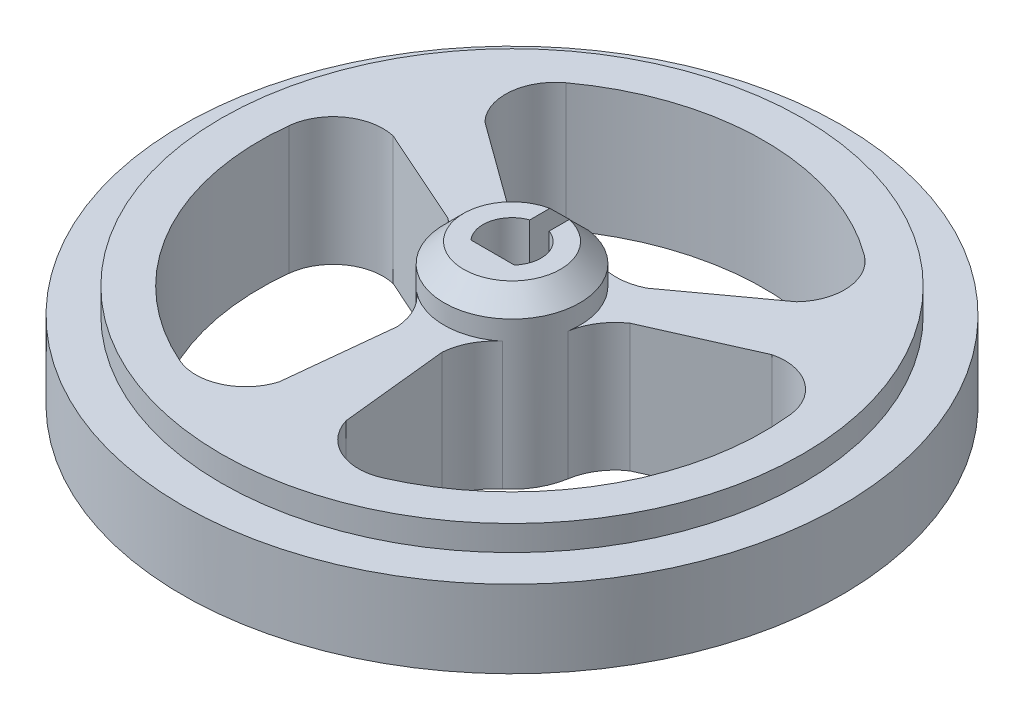
from build123d import *
from build123d.topology import SkipClean

# Parameters (mm, degrees)
SKETCH_1_R          = 15
EXTRUDE_1_DEPTH     = 6.6
EXTRUDE_2_DEPTH     = 2
SKETCH_3_R          = 17
SKETCH_3_R_2        = 15
EXTRUDE_3_DEPTH     = 5.3
SKETCH_4_R          = 17
SKETCH_4_R_2        = 15
CUT_EXTRUDE_3_DEPTH = 1.3


with BuildPart() as part:
    # 草图1 → 凸台-拉伸1 (new body)
    with BuildSketch(Plane(origin=(0, 0, 0), x_dir=(1, 0, 0), z_dir=(0, 1, 0))):
        with Locations(Location((0, 0, 0), (0, 0, 270))):
            Circle(SKETCH_1_R)
        with BuildLine():
            Line((1.118033989, -1), (-1.118033989, -1))
            ThreePointArc((-1.118033989, -1), (-1.4531398, 0.37200097), (-0.5, 1.414213562))
            Line((-0.5, 1.414213562), (-0.5, 3.464101615))
            ThreePointArc((-0.5, 3.464101615), (-0.874472135, 3.388996678), (-1.23853126, 3.273536363))
            ThreePointArc((-1.23853126, 3.273536363), (-2.407810688, 3.08721539), (-3.555224024, 3.379401158))
            Line((-3.555224024, 3.379401158), (-8.04299568, 6.641703286))
            ThreePointArc((-8.04299568, 6.641703286), (-8.733606232, 8.638127636), (-7.69519148, 10.477787366))
            ThreePointArc((-7.69519148, 10.477787366), (0, 13), (7.69519148, 10.477787366))
            ThreePointArc((7.69519148, 10.477787366), (8.733606232, 8.638127636), (8.04299568, 6.641703286))
            Line((8.04299568, 6.641703286), (3.555224024, 3.379401158))
            ThreePointArc((3.555224024, 3.379401158), (2.407810688, 3.08721539), (1.23853126, 3.273536363))
            ThreePointArc((1.23853126, 3.273536363), (0.874472135, 3.388996678), (0.5, 3.464101615))
            Line((0.5, 3.464101615), (0.5, 1.414213562))
            ThreePointArc((0.5, 1.414213562), (1.4531398, 0.37200097), (1.118033989, -1))
        make_face(mode=Mode.SUBTRACT)
        with BuildLine():
            Line((-1.149035241, -4.7686149), (-1.73038593, -10.286290225))
            ThreePointArc((-1.73038593, -10.286290225), (-3.114034858, -11.882588681), (-5.226434294, -11.903124992))
            ThreePointArc((-5.226434294, -11.903124992), (-11.258330249, -6.5), (-12.921625774, 1.425337626))
            ThreePointArc((-12.921625774, 1.425337626), (-11.847641089, 3.244461045), (-9.77338161, 3.644586939))
            Line((-9.77338161, 3.644586939), (-4.704259264, 1.389213742))
            ThreePointArc((-4.704259264, 1.389213742), (-3.877512299, 0.541617529), (-3.45423128, -0.564168647))
            ThreePointArc((-3.45423128, -0.564168647), (-3.031088913, -1.75), (-2.21570002, -2.709367716))
            ThreePointArc((-2.21570002, -2.709367716), (-1.469701611, -3.628832918), (-1.149035241, -4.7686149))
        make_face(mode=Mode.SUBTRACT)
        with BuildLine():
            Line((1.149035241, -4.7686149), (1.73038593, -10.286290225))
            ThreePointArc((1.73038593, -10.286290225), (3.114034858, -11.882588681), (5.226434294, -11.903124992))
            ThreePointArc((5.226434294, -11.903124992), (11.258330249, -6.5), (12.921625774, 1.425337626))
            ThreePointArc((12.921625774, 1.425337626), (11.847641089, 3.244461045), (9.77338161, 3.644586939))
            Line((9.77338161, 3.644586939), (4.704259264, 1.389213742))
            ThreePointArc((4.704259264, 1.389213742), (3.877512299, 0.541617529), (3.45423128, -0.564168647))
            ThreePointArc((3.45423128, -0.564168647), (3.031088913, -1.75), (2.21570002, -2.709367716))
            ThreePointArc((2.21570002, -2.709367716), (1.469701611, -3.628832918), (1.149035241, -4.7686149))
        make_face(mode=Mode.SUBTRACT)
    extrude(amount=EXTRUDE_1_DEPTH)

    # 草图2 → 凸台-拉伸2 (add)
    with BuildSketch(Plane(origin=(0, 6.6, 0), x_dir=(1, 0, 0), z_dir=(0, 1, 0))):
        with BuildLine():
            ThreePointArc((3.45423128, -0.564168647), (3.488539055, -0.283011059), (3.5, 0))
            ThreePointArc((3.5, 0), (2.879657915, 1.989364294), (1.23853126, 3.273536363))
            ThreePointArc((1.23853126, 3.273536363), (0.874472135, 3.388996678), (0.5, 3.464101615))
            Line((0.5, 3.464101615), (0.5, 1.414213562))
            ThreePointArc((0.5, 1.414213562), (1.4531398, 0.37200097), (1.118033989, -1))
            Line((1.118033989, -1), (-1.118033989, -1))
            ThreePointArc((-1.118033989, -1), (-1.4531398, 0.37200097), (-0.5, 1.414213562))
            Line((-0.5, 1.414213562), (-0.5, 3.464101615))
            ThreePointArc((-0.5, 3.464101615), (-0.874472135, 3.388996678), (-1.23853126, 3.273536363))
            ThreePointArc((-1.23853126, 3.273536363), (-3.031088913, 1.75), (-3.45423128, -0.564168647))
            ThreePointArc((-3.45423128, -0.564168647), (-3.031088913, -1.75), (-2.21570002, -2.709367716))
            ThreePointArc((-2.21570002, -2.709367716), (0, -3.5), (2.21570002, -2.709367716))
            ThreePointArc((2.21570002, -2.709367716), (3.031088913, -1.75), (3.45423128, -0.564168647))
        make_face()
    extrude(amount=EXTRUDE_2_DEPTH)

    # 倒角1: read off the stored shape, not the designer's step
    # 倒角1 outline → 倒角1 (revolve, cut)
    with BuildSketch(Plane.XY):
        Polygon((3.5, 8.6), (2.5, 8.6), (3.5, 7.6), align=None)
    revolve(axis=Axis((0, 0, 0), (0, 1, 0)), mode=Mode.SUBTRACT)

    # 草图3 → 凸台-拉伸3 (add)
    with SkipClean():  # the faces are left unmerged after this step: merging them gives an invalid solid
        with BuildSketch(Plane(origin=(0, 0, 0), x_dir=(1, 0, 0), z_dir=(0, 1, 0))):
            with Locations(Location((0, 0, 0), (0, 0, 270))):
                Circle(SKETCH_3_R)
            with Locations(Location((0, 0, 0), (0, 0, 270))):
                Circle(SKETCH_3_R_2, mode=Mode.SUBTRACT)
        extrude(amount=EXTRUDE_3_DEPTH)

    # 草图4 → 切除-拉伸3 (cut)
    with SkipClean():  # the faces are left unmerged after this step: merging them gives an invalid solid
        with BuildSketch(Plane.XZ):
            with Locations(Location((0, 0, 0), (0, 0, 270))):
                Circle(SKETCH_4_R)
            with Locations(Location((0, 0, 0), (0, 0, 90))):
                Circle(SKETCH_4_R_2, mode=Mode.SUBTRACT)
        extrude(amount=-CUT_EXTRUDE_3_DEPTH, mode=Mode.SUBTRACT)


solid = part.part
